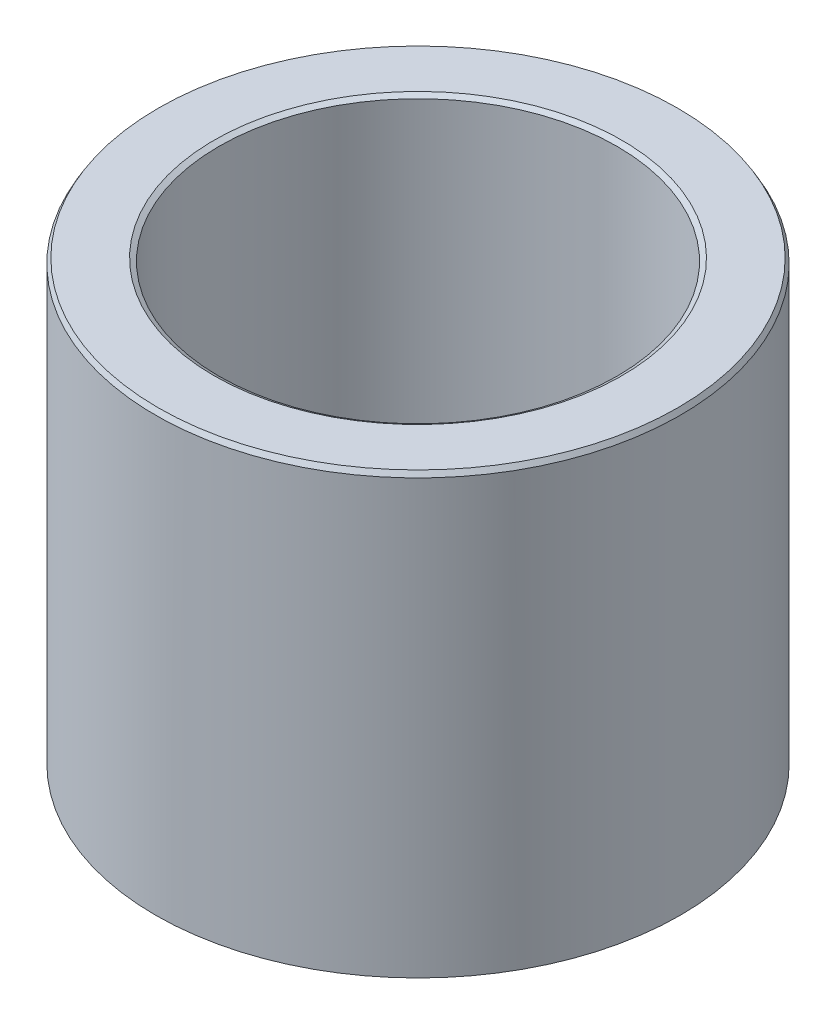
from build123d import *
from OCP.BRepFilletAPI import BRepFilletAPI_MakeChamfer

# Parameters (mm, degrees)
SKETCH1_R           = 17.5
BOSS_EXTRUDE1_DEPTH = 29.390861593
SKETCH2_R           = 13.273745785
CUT_EXTRUDE1_DEPTH  = 39.422945556
CHAMFER1_SIZE       = 0.32729549
CHAMFER1_SIZE2      = 0.188964139


with BuildPart() as part:
    # Sketch1 → Boss-Extrude1 (new body)
    with BuildSketch(Plane(origin=(0, 0, 0), x_dir=(1, 0, 0), z_dir=(0, 1, 0))):
        Circle(SKETCH1_R)
    extrude(amount=BOSS_EXTRUDE1_DEPTH)

    # Sketch2 → Cut-Extrude1 (cut, through all)
    with BuildSketch(Plane(origin=(0, 0, 0), x_dir=(1, 0, 0), z_dir=(0, 1, 0))):
        Circle(SKETCH2_R)
    extrude(amount=CUT_EXTRUDE1_DEPTH, mode=Mode.SUBTRACT)

    # Chamfer1: one chamfer whose edges measure the first distance from different faces: ONE call of the kernel's chamfer builder (chamfer() names one face for all edges)
    chamfer1_edges_1 = [part.edges().sort_by_distance(p)[0] for p in [
        (-13.273745785, 29.390861593, 0),
    ]]
    chamfer1_side_1 = [part.faces().sort_by_distance(p)[0] for p in [
        (-17.005025253, 29.390861593, 0),
    ]]
    chamfer1_edges_2 = [part.edges().sort_by_distance(p)[0] for p in [
        (-13.273745785, 0, 0),
    ]]
    chamfer1_side_2 = [part.faces().sort_by_distance(p)[0] for p in [
        (-13.273745785, 14.695430797, 0),
    ]]
    chamfer1_edges_3 = [part.edges().sort_by_distance(p)[0] for p in [
        (-17.5, 0, 0),
    ]]
    chamfer1_side_3 = [part.faces().sort_by_distance(p)[0] for p in [
        (-17.005025253, 0, 0),
    ]]
    chamfer1_edges_4 = [part.edges().sort_by_distance(p)[0] for p in [
        (-17.5, 29.390861593, 0),
    ]]
    chamfer1_side_4 = [part.faces().sort_by_distance(p)[0] for p in [
        (-17.5, 14.695430797, 0),
    ]]
    chamfer1 = BRepFilletAPI_MakeChamfer(part.part.solid().wrapped)
    for e in chamfer1_edges_1:
        chamfer1.Add(CHAMFER1_SIZE, CHAMFER1_SIZE2, e.wrapped, chamfer1_side_1[0].wrapped)  # the first distance lies on this face
    for e in chamfer1_edges_2:
        chamfer1.Add(CHAMFER1_SIZE, CHAMFER1_SIZE2, e.wrapped, chamfer1_side_2[0].wrapped)  # the first distance lies on this face
    for e in chamfer1_edges_3:
        chamfer1.Add(CHAMFER1_SIZE, CHAMFER1_SIZE2, e.wrapped, chamfer1_side_3[0].wrapped)  # the first distance lies on this face
    for e in chamfer1_edges_4:
        chamfer1.Add(CHAMFER1_SIZE, CHAMFER1_SIZE2, e.wrapped, chamfer1_side_4[0].wrapped)  # the first distance lies on this face
    add(Compound.cast(chamfer1.Shape()), mode=Mode.REPLACE)


solid = part.part
